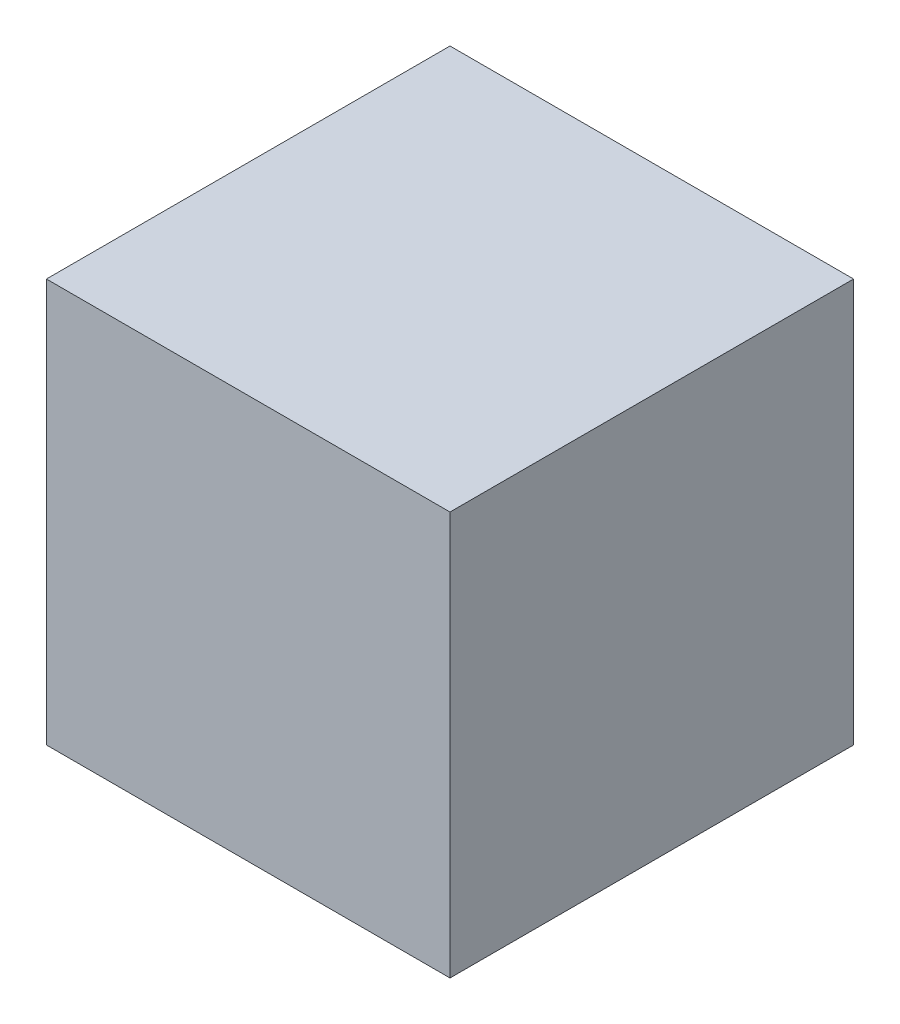
from build123d import *

# Parameters (mm, degrees)
BOSS_EXTRUDE1_DEPTH      = 28
BOSS_EXTRUDE1_DEPTH_BACK = 28
SKETCH1_W                = 56
SKETCH1_H                = 56


with BuildPart() as part:
    # Sketch1 → Boss-Extrude1 (new, two sides: drawn at the far end of the back side and taken through both)
    with BuildSketch(Plane(origin=(0, 0, 0), x_dir=(1, 0, 0), z_dir=(0, 1, 0)).offset(-BOSS_EXTRUDE1_DEPTH_BACK)):
        Rectangle(SKETCH1_W, SKETCH1_H)
    extrude(amount=BOSS_EXTRUDE1_DEPTH + BOSS_EXTRUDE1_DEPTH_BACK)


solid = part.part
